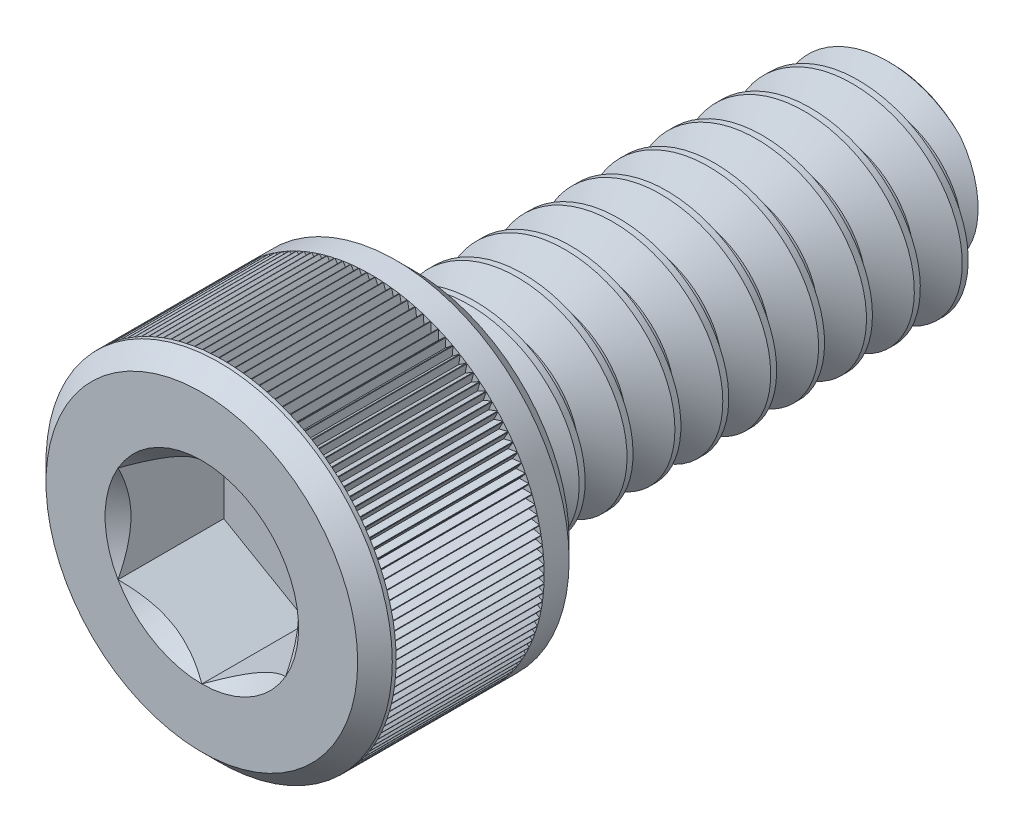
from build123d import *

# Parameters (mm, degrees)
CUT_EXTRUDE1_DEPTH = 1.7526
CUT_SWEEP1_PITCH   = 0.79375
CUT_EXTRUDE3_START = 1.40208
CUT_EXTRUDE3_DEPTH = 2.45364
CIRPATTERN1_COUNT  = 134


# Read off the part's stored shape, not the designer's step: Split1
with BuildPart() as part:
    # Sketch2 → Revolve1 (revolve)
    with BuildSketch(Plane(origin=(0, 0, 0), x_dir=(0, 0, -1), z_dir=(1, 0, 0)), mode=Mode.PRIVATE) as revolve1_sk:
        Polygon((7.9375, 1.57734), (7.76224, 1.7526), (0, 1.7526), (0, 2.58318), (-0.28702, 2.8702), (-3.21818, 2.8702), (-3.5052, 2.58318), (-3.5052, 1.3890625), (-1.7526, 1.3890625), (-1.7526, 0), (7.9375, 0), align=None)
    revolve(revolve1_sk.sketch.rotate(Axis((0, 0, 1.7526), (0, 0, -1)), 90), axis=Axis((0, 0, 1.7526), (0, 0, -1)))

    # Sketch3 → Cut-Extrude1 (cut)
    with BuildSketch(Plane.XY.offset(3.5052)):
        Polygon((0, 1.603951217), (-1.3890625, 0.801975608), (-1.3890625, -0.801975608), (0, -1.603951217), (1.3890625, -0.801975608), (1.3890625, 0.801975608), align=None)
    extrude(amount=-CUT_EXTRUDE1_DEPTH, mode=Mode.SUBTRACT)

    # Cut-Extrude2 cone 1 section (through the dimple's axis) → Cut-Extrude2 (revolve, cut)
    with BuildSketch(Plane(origin=(0, 0, 3.5052), x_dir=(0, -1, 0), z_dir=(1, 0, 0))):
        Polygon((0, 0), (1.603951217, 0), (0, 1.603951217), align=None)
    revolve(axis=Axis((0, 0, 3.5052), (0, 0, -1)), mode=Mode.SUBTRACT)


with BuildPart() as body_2:
    # Split1: the piece on the far side of the plane
    add(part.part)
    split(bisect_by=Plane.XY, keep=Keep.BOTTOM)

    # Cut-Sweep1: the profile of Sketch7 screwed along a right-hand helix of 11 turns, 8 arcs to a turn; built about Z, then put on its axis
    cut_sweep1_z = Axis((0, 0, 0), (0, 0, 1))
    cut_sweep1_corners = [(1.795562979, 0, -0.719335937), (1.838525958, 0, 0.049609375), (1.237044252, 0, -0.29765625), (1.237044252, 0, -0.396875)]
    with BuildLine(mode=Mode.PRIVATE) as cut_sweep1_profile:
        Line(cut_sweep1_corners[0], cut_sweep1_corners[1])
        Line(cut_sweep1_corners[1], cut_sweep1_corners[2])
        Line(cut_sweep1_corners[2], cut_sweep1_corners[3])
        Line(cut_sweep1_corners[3], cut_sweep1_corners[0])
    cut_sweep1_cap = Face(cut_sweep1_profile.wire())
    cut_sweep1_turn_angles = [0, 22.5, 45, 67.5, 90, 112.5, 135, 157.5, 180, 202.5, 225, 247.5, 270, 292.5, 315, 337.5, 360]
    cut_sweep1_turn_weights = [1, 0.9238795325112867, 1, 0.9238795325112867, 1, 0.9238795325112867, 1, 0.9238795325112867, 1, 0.9238795325112867, 1, 0.9238795325112867, 1, 0.9238795325112867, 1, 0.9238795325112867, 1]
    cut_sweep1_turn_rails = [Edge.make_bspline([Vector(p[0], p[1], 0).rotate(cut_sweep1_z, cut_sweep1_turn_angles[k]) / cut_sweep1_turn_weights[k] + Vector(0, 0, p[2] + CUT_SWEEP1_PITCH * cut_sweep1_turn_angles[k] / 360) for k in range(17)], [0, 0, 0, 1, 1, 2, 2, 3, 3, 4, 4, 5, 5, 6, 6, 7, 7, 8, 8, 8], 2, cut_sweep1_turn_weights) for p in cut_sweep1_corners]
    cut_sweep1_turn_sides = [Face.make_surface_from_curves(cut_sweep1_turn_rails[p[0]], cut_sweep1_turn_rails[p[1]]) for p in [(0, 1), (1, 2), (2, 3), (3, 0)]]
    cut_sweep1 = Plane(origin=(0, 0, 0), x_dir=(0, 1, 0), z_dir=(0, 0, -1)) * Solid(Shell([*[p.moved(Location((0, 0, CUT_SWEEP1_PITCH * i))) for i in range(11) for p in cut_sweep1_turn_sides], cut_sweep1_cap, cut_sweep1_cap.rotate(cut_sweep1_z, 3960).moved(Location((0, 0, CUT_SWEEP1_PITCH * 3960 / 360)))]))
    add(cut_sweep1, mode=Mode.SUBTRACT)


with BuildPart() as part_1:
    add(part.part)

    # Split1
    split(bisect_by=Plane.XY, keep=Keep.TOP)

    # Combine1: union body 2
    add(body_2.part)

    # Sketch8 → Cut-Extrude3 (cut)
    with BuildSketch(Plane.XY.offset(1.7526).offset(CUT_EXTRUDE3_START)):
        with BuildLine():
            Line((-0.062613083, 2.86951697), (0, 2.72669))
            Line((0, 2.72669), (0.062613083, 2.86951697))
            ThreePointArc((0.062613083, 2.86951697), (0, 2.8702), (-0.062613083, 2.86951697))
        make_face()
    cut_extrude3 = extrude(amount=-CUT_EXTRUDE3_DEPTH, mode=Mode.SUBTRACT)

    # CirPattern1: Cut-Extrude3 ×134 about axis
    cirpattern1_axis = Axis((0, 0, 0), (0, 0, 1))
    for i in range(1, CIRPATTERN1_COUNT):
        add(cut_extrude3.rotate(cirpattern1_axis, i * 360 / CIRPATTERN1_COUNT), mode=Mode.SUBTRACT)


solid = part_1.part
